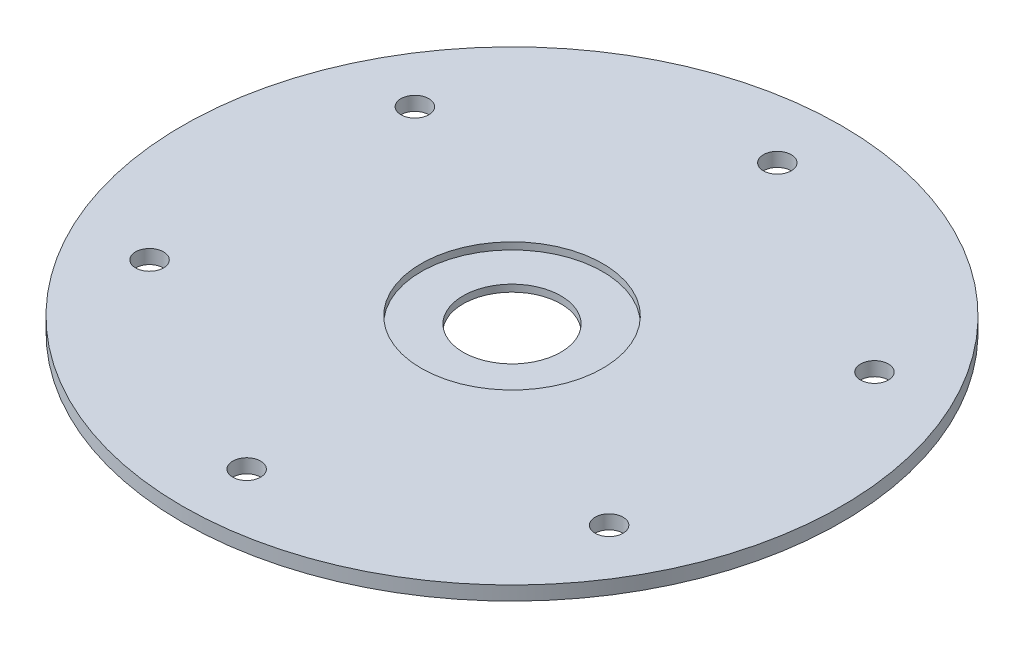
from build123d import *

# Parameters (mm, degrees)
SKETCH1_R           = 47.2
BOSS_EXTRUDE1_DEPTH = 2
SKETCH2_R           = 13
CUT_EXTRUDE1_DEPTH  = 1
SKETCH3_R           = 7
CUT_EXTRUDE2_DEPTH  = 67.758370262
SKETCH4_R           = 2
CUT_EXTRUDE3_DEPTH  = 67.780835574
CIRPATTERN1_COUNT   = 6


with BuildPart() as part:
    # Sketch1 → Boss-Extrude1 (new body)
    with BuildSketch(Plane(origin=(0, 0, 0), x_dir=(1, 0, 0), z_dir=(0, 1, 0))):
        Circle(SKETCH1_R)
    extrude(amount=BOSS_EXTRUDE1_DEPTH)

    # Sketch2 → Cut-Extrude1 (cut)
    with BuildSketch(Plane(origin=(0, 2, 0), x_dir=(1, 0, 0), z_dir=(0, 1, 0))):
        Circle(SKETCH2_R)
    extrude(amount=-CUT_EXTRUDE1_DEPTH, mode=Mode.SUBTRACT)

    # Sketch3 → Cut-Extrude2 (cut, through all)
    with BuildSketch(Plane(origin=(0, 1, 0), x_dir=(1, 0, 0), z_dir=(0, 1, 0))):
        Circle(SKETCH3_R)
    extrude(amount=-CUT_EXTRUDE2_DEPTH, mode=Mode.SUBTRACT)

    # Sketch4 → Cut-Extrude3 (cut, through all)
    with BuildSketch(Plane(origin=(0, 2, 0), x_dir=(1, 0, 0), z_dir=(0, 1, 0))):
        with Locations((0, 38)):
            Circle(SKETCH4_R)
    cut_extrude3 = extrude(amount=-CUT_EXTRUDE3_DEPTH, mode=Mode.SUBTRACT)

    # CirPattern1: Cut-Extrude3 ×6 about axis
    cirpattern1_axis = Axis((0, 2, 0), (0, 1, 0))
    for i in range(1, CIRPATTERN1_COUNT):
        add(cut_extrude3.rotate(cirpattern1_axis, i * 360 / CIRPATTERN1_COUNT), mode=Mode.SUBTRACT)


solid = part.part
